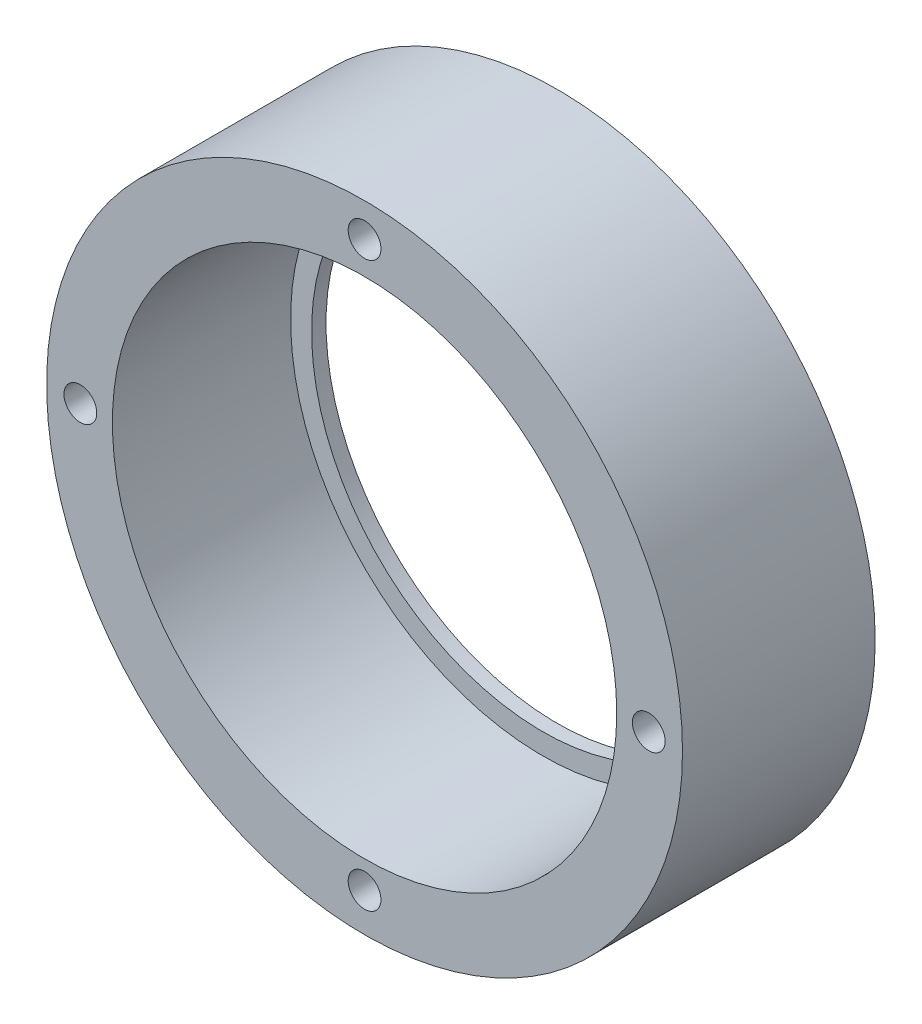
from build123d import *

# Parameters (mm, degrees)
SKETCH1_R           = 33
SKETCH1_R_2         = 24
BOSS_EXTRUDE1_DEPTH = 1.5
SKETCH3_R           = 33
SKETCH3_R_2         = 26.175
BOSS_EXTRUDE2_DEPTH = 18.5
SKETCH4_R           = 1.7
CUT_EXTRUDE1_DEPTH  = 51.774009099
CHAMFER1_SIZE       = 0.4


with BuildPart() as part:
    # Sketch1 → Boss-Extrude1 (new body)
    with BuildSketch(Plane.XY):
        Circle(SKETCH1_R)
        Circle(SKETCH1_R_2, mode=Mode.SUBTRACT)
    extrude(amount=BOSS_EXTRUDE1_DEPTH)

    # Sketch3 → Boss-Extrude2 (add)
    with BuildSketch(Plane.XY.offset(1.5)):
        Circle(SKETCH3_R)
        Circle(SKETCH3_R_2, mode=Mode.SUBTRACT)
    extrude(amount=BOSS_EXTRUDE2_DEPTH)

    # Sketch4 → Cut-Extrude1 (cut, through all)
    with BuildSketch(Plane.XY.offset(20)):
        with Locations((0, 29.5)):
            Circle(SKETCH4_R)
        with Locations((29.5, 0)):
            Circle(SKETCH4_R)
        with Locations((0, -29)):
            Circle(SKETCH4_R)
        with Locations((-29.5, 0)):
            Circle(SKETCH4_R)
    extrude(amount=-CUT_EXTRUDE1_DEPTH, mode=Mode.SUBTRACT)

    # Chamfer1
    chamfer1_edges = [part.edges().sort_by_distance(p)[0] for p in [
        (-1.7, -29, 0),
        (27.8, 0, 0),
        (-31.2, 0, 0),
        (-1.7, 29.5, 0),
    ]]
    chamfer(chamfer1_edges, length=CHAMFER1_SIZE)


solid = part.part
